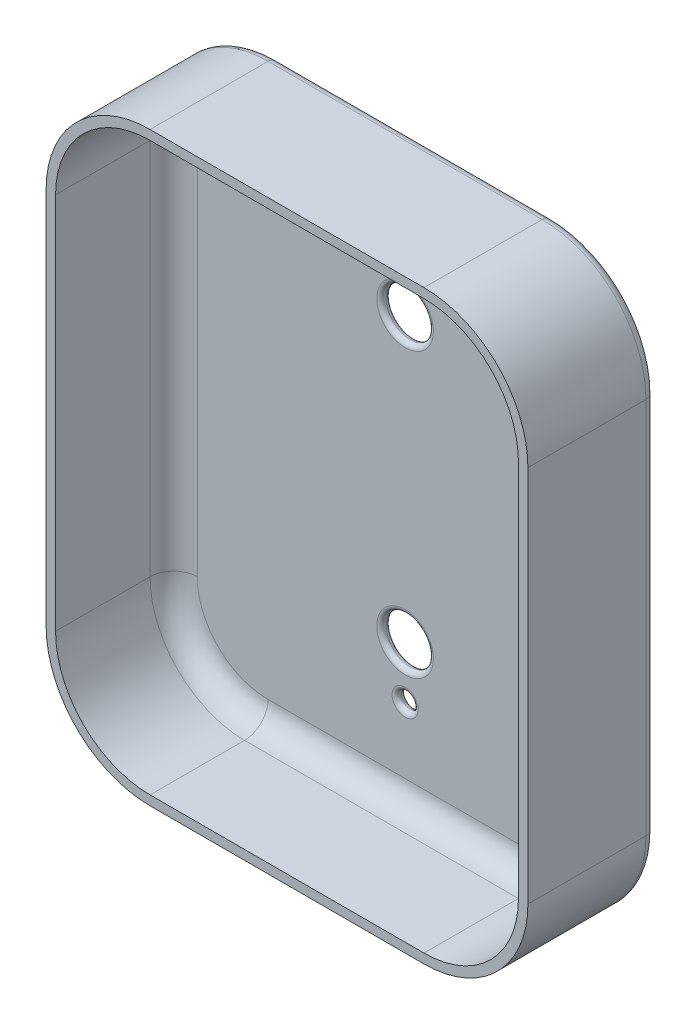
from build123d import *

# Parameters (mm, degrees)
BOSS_EXTRUDE7_DEPTH = 25
BOSS_EXTRUDE9_START = -2
SKETCH6_R           = 1.75
SKETCH6_R_2         = 5
BOSS_EXTRUDE9_DEPTH = 2
FILLET1_R           = 5
FILLET2_R           = 2
FILLET3_R           = 1


with BuildPart() as part:
    # Sketch1 → Boss-Extrude7 (new body)
    with BuildSketch(Plane.XY):
        with BuildLine():
            Line((-29, 62), (29, 62))
            ThreePointArc((29, 62), (44.556349186, 55.556349186), (51, 40))
            Line((51, 40), (51, -40))
            ThreePointArc((51, -40), (44.556349186, -55.556349186), (29, -62))
            Line((29, -62), (-29, -62))
            ThreePointArc((-29, -62), (-44.556349186, -55.556349186), (-51, -40))
            Line((-51, -40), (-51, 40))
            ThreePointArc((-51, 40), (-44.556349186, 55.556349186), (-29, 62))
        make_face()
        with BuildLine():
            Line((-29, 60), (29, 60))
            ThreePointArc((29, 60), (43.142135624, 54.142135624), (49, 40))
            Line((49, 40), (49, -40))
            ThreePointArc((49, -40), (43.142135624, -54.142135624), (29, -60))
            Line((29, -60), (-29, -60))
            ThreePointArc((-29, -60), (-43.142135624, -54.142135624), (-49, -40))
            Line((-49, -40), (-49, 40))
            ThreePointArc((-49, 40), (-43.142135624, 54.142135624), (-29, 60))
        make_face(mode=Mode.SUBTRACT)
    extrude(amount=BOSS_EXTRUDE7_DEPTH)

    # Sketch6 → Boss-Extrude9 (add)
    with BuildSketch(Plane.XY.offset(BOSS_EXTRUDE9_START)):
        with BuildLine():
            Line((-29, 62), (29, 62))
            ThreePointArc((29, 62), (44.556349186, 55.556349186), (51, 40))
            Line((51, 40), (51, -40))
            ThreePointArc((51, -40), (44.556349186, -55.556349186), (29, -62))
            Line((29, -62), (-29, -62))
            ThreePointArc((-29, -62), (-44.556349186, -55.556349186), (-51, -40))
            Line((-51, -40), (-51, 40))
            ThreePointArc((-51, 40), (-44.556349186, 55.556349186), (-29, 62))
        make_face()
        with Locations((0, 41)):
            Circle(SKETCH6_R, mode=Mode.SUBTRACT)
        with Locations((0, -41)):
            Circle(SKETCH6_R, mode=Mode.SUBTRACT)
        with Locations((0, 30)):
            Circle(SKETCH6_R_2, mode=Mode.SUBTRACT)
        with Locations((0, -30)):
            Circle(SKETCH6_R_2, mode=Mode.SUBTRACT)
    extrude(amount=BOSS_EXTRUDE9_DEPTH)

    # Fillet1
    fillet1_edges = [part.edges().sort_by_distance(p)[0] for p in [
        (43.142135624, 54.142135624, 0),
        (0, 60, 0),
        (-43.142135624, 54.142135624, 0),
        (-49, 0, 0),
        (-43.142135624, -54.142135624, 0),
        (0, -60, 0),
        (43.142135624, -54.142135624, 0),
        (49, 0, 0),
    ]]
    fillet(fillet1_edges, radius=FILLET1_R)

    # Fillet2
    fillet2_edges = [part.edges().sort_by_distance(p)[0] for p in [
        (-44.556349186, 55.556349186, -2),
        (0, 62, -2),
        (44.556349186, 55.556349186, -2),
        (51, 0, -2),
        (44.556349186, -55.556349186, -2),
        (0, -62, -2),
        (-44.556349186, -55.556349186, -2),
        (-51, 0, -2),
    ]]
    fillet(fillet2_edges, radius=FILLET2_R)

    # Fillet3
    fillet3_edges = [part.edges().sort_by_distance(p)[0] for p in [
        (-5, -30, -2),
        (-5, 30, -2),
        (-1.75, -41, -2),
        (-1.75, 41, -2),
        (-1.75, 41, 0),
        (-1.75, -41, 0),
        (-5, 30, 0),
        (-5, -30, 0),
    ]]
    fillet(fillet3_edges, radius=FILLET3_R - 0.0001)  # a hair under: the kernel refuses the full size


solid = part.part
